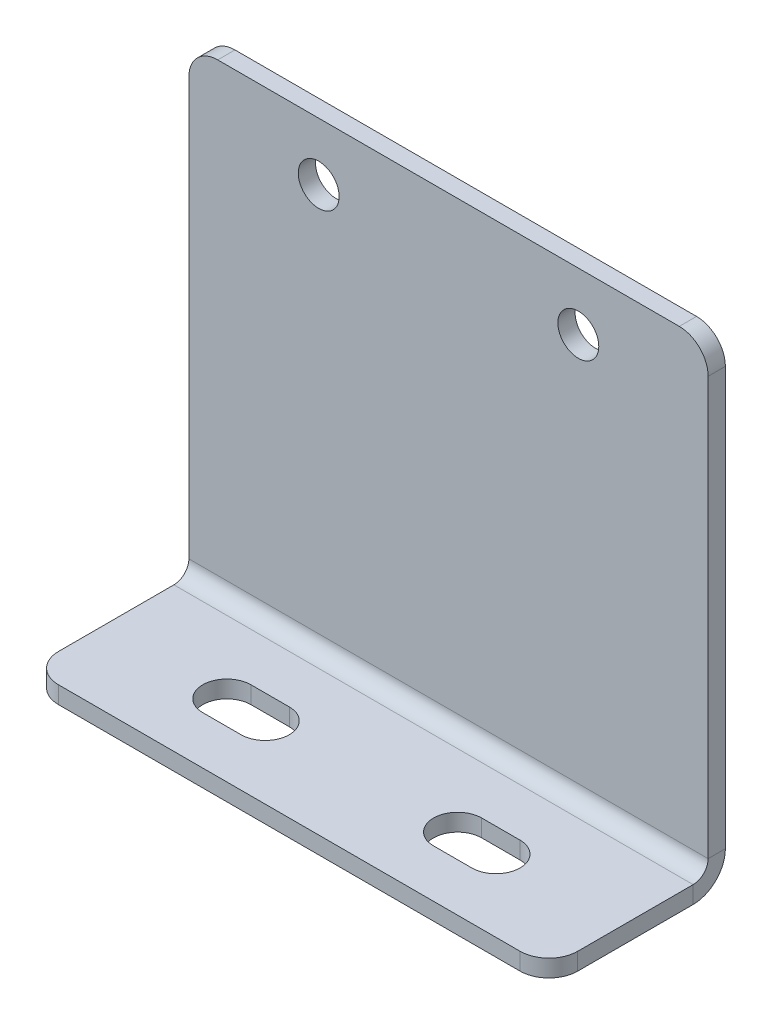
from build123d import *

# Parameters (mm, degrees)
SKETCH1_W                      = 57.15
SKETCH1_H                      = 15.875
BASE_FLANGE1_DEPTH             = 1.89738
EDGE_FLANGE1_DEPTH             = 57.15
F_4_START                      = -1.89738
F_4_0_209_DIAMETER_SLOT1_DEPTH = 1.89738
F_4_5_4_5_DIAMETER_HOLE1_D     = 4.5
FILLET1_R                      = 3.175


# Read off the part's stored shape, not the designer's step: #4 (0.209) Diameter Slot1
# Sheet-metal steps are written as plain solids
with BuildPart() as part:
    # Sketch1 → Base-Flange1 (new body)
    with BuildSketch(Plane(origin=(0, 0, 0), x_dir=(1, 0, 0), z_dir=(0, 1, 0))):
        with Locations((28.575, 7.9375)):
            Rectangle(SKETCH1_W, SKETCH1_H)
    extrude(amount=-BASE_FLANGE1_DEPTH)

    # Edge-Flange1 section (across the edge) → Edge-Flange1 (add)
    with BuildSketch(Plane(origin=(57.15, 0, -17.526), x_dir=(0, 0, 1), z_dir=(-1, 0, 0))):
        with BuildLine():
            Line((-1.89738, 1.651), (-1.89738, 50.8))
            Line((-1.89738, 50.8), (0, 50.8))
            Line((0, 50.8), (0, 1.651))
            ThreePointArc((0, 1.651), (0.483566704, 0.483566704), (1.651, 0))
            Line((1.651, 0), (1.651, -1.89738))
            ThreePointArc((1.651, -1.89738), (-0.85808356, -0.85808356), (-1.89738, 1.651))
        make_face()
    extrude(amount=EDGE_FLANGE1_DEPTH)

    # #4 (0.209) Diameter Slot1 outline → #4 (0.209) Diameter Slot1 (cut)
    with BuildSketch(Plane(origin=(0, 0, 0), x_dir=(1, 0, 0), z_dir=(0, 1, 0)).offset(F_4_START)):
        with BuildLine():
            Line((39.1668, 5.2832), (43.3832, 5.2832))
            ThreePointArc((43.3832, 5.2832), (46.0375, 7.9375), (43.3832, 10.5918))
            Line((43.3832, 10.5918), (39.1668, 10.5918))
            ThreePointArc((39.1668, 10.5918), (36.5125, 7.9375), (39.1668, 5.2832))
        make_face()
        with BuildLine():
            ThreePointArc((17.9832, 5.2832), (20.6375, 7.9375), (17.9832, 10.5918))
            Line((17.9832, 10.5918), (13.7668, 10.5918))
            ThreePointArc((13.7668, 10.5918), (11.1125, 7.9375), (13.7668, 5.2832))
            Line((13.7668, 5.2832), (17.9832, 5.2832))
        make_face()
    extrude(amount=F_4_0_209_DIAMETER_SLOT1_DEPTH, mode=Mode.SUBTRACT)

    # Ø4.5 (4.5) Diameter Hole1 (through all)
    with Locations(Plane.XY.offset(-17.526)):
        with Locations((14.2875, 44.45), (42.8625, 44.45)):
            Hole(F_4_5_4_5_DIAMETER_HOLE1_D / 2)

    # Fillet1
    fillet1_edges = [part.edges().sort_by_distance(p)[0] for p in [
        (57.15, 50.8, -18.47469),
        (0, 50.8, -18.47469),
        (57.15, -0.94869, 0),
        (0, -0.94869, 0),
    ]]
    fillet(fillet1_edges, radius=FILLET1_R)


solid = part.part
